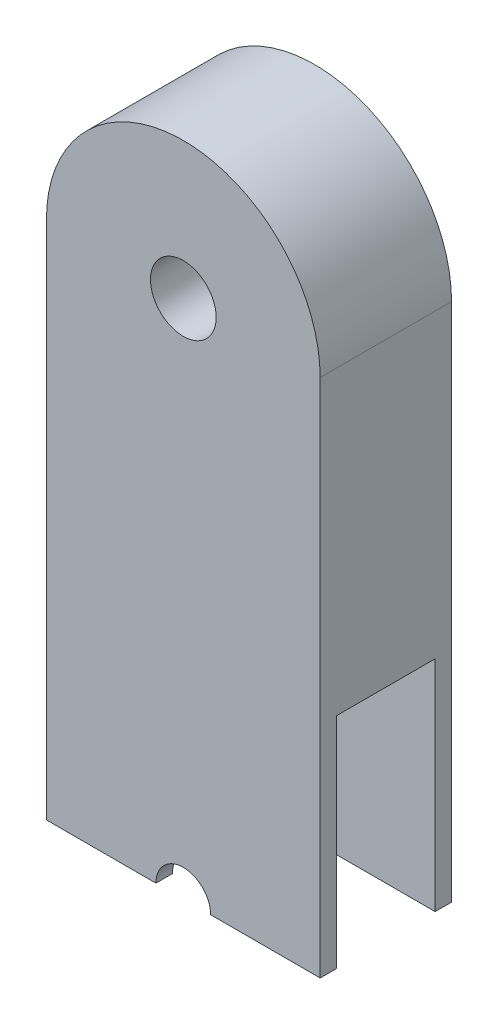
from build123d import *

# Parameters (mm, degrees)
SKETCH1_W           = 24
SKETCH1_H           = 120
BOSS_EXTRUDE1_DEPTH = 50
SKETCH3_R           = 6
CUT_EXTRUDE1_DEPTH  = 133.196822957
SKETCH5_R           = 5
CUT_EXTRUDE4_DEPTH  = 133.196822957
SKETCH4_W           = 18
SKETCH4_H           = 80
CUT_EXTRUDE5_DEPTH  = 133.196822957
CUT_EXTRUDE7_START  = -24
CUT_EXTRUDE7_DEPTH  = 24
FILLET2_R           = 1


# Read off the part's stored shape, not the designer's step: Cut-Extrude7
with BuildPart() as part:
    # Sketch1 → Boss-Extrude1 (new body)
    with BuildSketch(Plane(origin=(0, 0, 0), x_dir=(0, 0, -1), z_dir=(1, 0, 0))):
        with Locations((-12, -60)):
            Rectangle(SKETCH1_W, SKETCH1_H)
    extrude(amount=BOSS_EXTRUDE1_DEPTH)

    # Sketch3 → Cut-Extrude1 (cut, through all)
    with BuildSketch(Plane.XY.offset(24)):
        with Locations((25, -25)):
            Circle(SKETCH3_R)
    extrude(amount=-CUT_EXTRUDE1_DEPTH, mode=Mode.SUBTRACT)

    # Sketch5 → Cut-Extrude4 (cut, through all)
    with BuildSketch(Plane.XY.offset(24)):
        with Locations((25, -120)):
            Circle(SKETCH5_R)
    extrude(amount=-CUT_EXTRUDE4_DEPTH, mode=Mode.SUBTRACT)

    # Sketch4 → Cut-Extrude5 (cut, through all)
    with BuildSketch(Plane(origin=(50, 0, 0), x_dir=(0, 0, -1), z_dir=(1, 0, 0))):
        with Locations((-12, -120)):
            Rectangle(SKETCH4_W, SKETCH4_H)
    extrude(amount=-CUT_EXTRUDE5_DEPTH, mode=Mode.SUBTRACT)

    # Cut-Extrude7 outline → Cut-Extrude7 (cut)
    with BuildSketch(Plane.XY.offset(24).offset(CUT_EXTRUDE7_START)):
        with BuildLine():
            Line((0, 0), (0, -25))
            ThreePointArc((0, -25), (7.32233047, -7.32233047), (25, 0))
            Line((25, 0), (0, 0))
        make_face()
        with BuildLine():
            Line((50, 0), (25, 0))
            ThreePointArc((25, 0), (42.67766953, -7.32233047), (50, -25))
            Line((50, -25), (50, 0))
        make_face()
    extrude(amount=CUT_EXTRUDE7_DEPTH, mode=Mode.SUBTRACT)

    # Fillet2
    fillet2_edges = [part.edges().sort_by_distance(p)[0] for p in [
        (19, -25, 0),
    ]]
    fillet(fillet2_edges, radius=FILLET2_R)


solid = part.part
